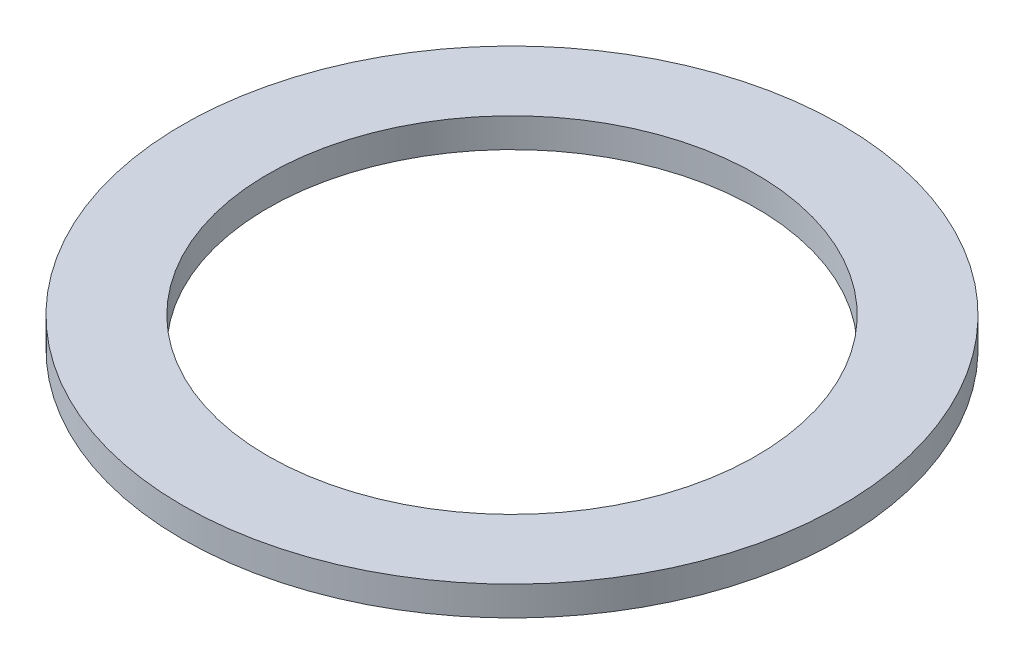
from build123d import *

# Parameters (mm, degrees)
SKETCH1_R           = 67.5
BOSS_EXTRUDE1_DEPTH = 6
SKETCH2_R           = 50
CUT_EXTRUDE1_DEPTH  = 96.647791402


with BuildPart() as part:
    # Sketch1 → Boss-Extrude1 (new body)
    with BuildSketch(Plane(origin=(0, 0, 0), x_dir=(1, 0, 0), z_dir=(0, 1, 0))):
        Circle(SKETCH1_R)
    extrude(amount=BOSS_EXTRUDE1_DEPTH)

    # Sketch2 → Cut-Extrude1 (cut, through all)
    with BuildSketch(Plane(origin=(0, 0, 0), x_dir=(1, 0, 0), z_dir=(0, 1, 0))):
        Circle(SKETCH2_R)
    extrude(amount=CUT_EXTRUDE1_DEPTH, mode=Mode.SUBTRACT)


solid = part.part
